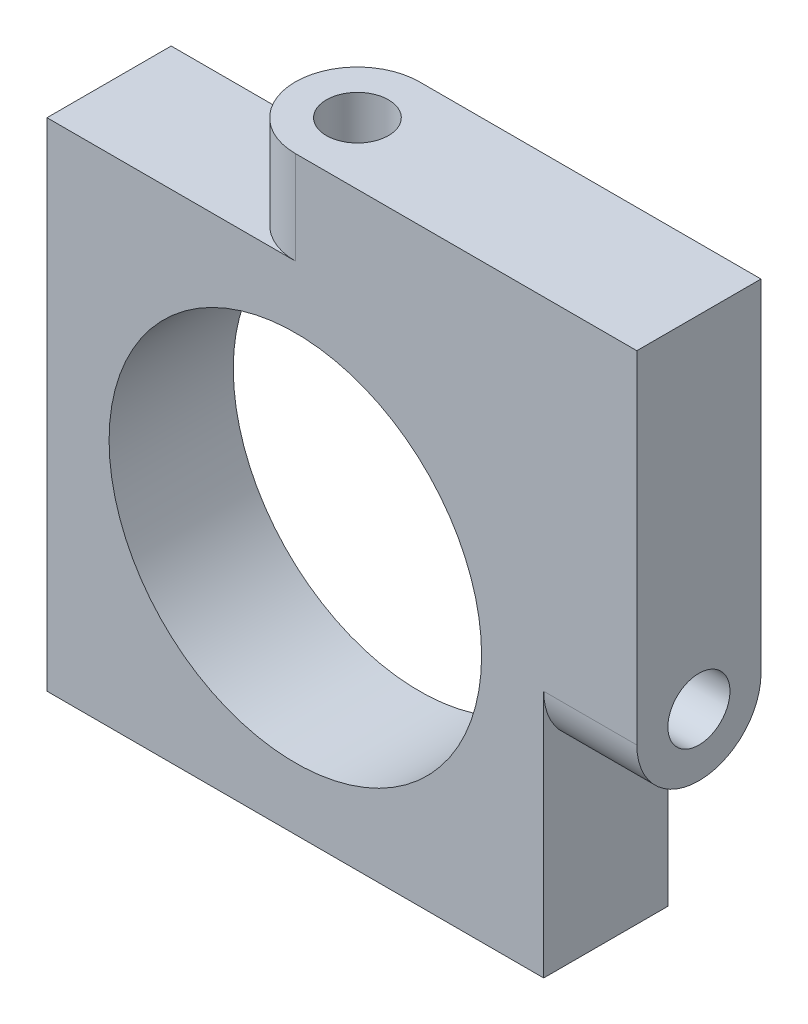
from build123d import *

# Parameters (mm, degrees)
SKETCH2_W           = 101.6
SKETCH2_H           = 101.6
SKETCH2_R           = 38.1
BOSS_EXTRUDE1_DEPTH = 25.4
SKETCH3_R           = 6.35
BOSS_EXTRUDE2_DEPTH = 19.05
SKETCH4_R           = 6.35
BOSS_EXTRUDE3_DEPTH = 19.05


with BuildPart() as part:
    # Sketch2 → Boss-Extrude1 (new body)
    with BuildSketch(Plane.XY):
        with Locations((50.8, 50.8)):
            Rectangle(SKETCH2_W, SKETCH2_H)
        with Locations((50.8, 50.8)):
            Circle(SKETCH2_R, mode=Mode.SUBTRACT)
    extrude(amount=BOSS_EXTRUDE1_DEPTH)

    # Sketch3 → Boss-Extrude2 (add)
    with BuildSketch(Plane(origin=(0, 101.6, 0), x_dir=(1, 0, 0), z_dir=(0, 1, 0))):
        with BuildLine():
            Line((101.6, -25.4), (101.6, 0))
            Line((101.6, 0), (50.8, 0))
            ThreePointArc((50.8, 0), (38.1, -12.7), (50.8, -25.4))
            Line((50.8, -25.4), (101.6, -25.4))
        make_face()
        with Locations((50.8, -12.7)):
            Circle(SKETCH3_R, mode=Mode.SUBTRACT)
    extrude(amount=BOSS_EXTRUDE2_DEPTH)

    # Sketch4 → Boss-Extrude3 (add)
    with BuildSketch(Plane(origin=(101.6, 0, 0), x_dir=(0, 0, -1), z_dir=(1, 0, 0))):
        with BuildLine():
            Line((0, 120.65), (-25.4, 120.65))
            Line((-25.4, 120.65), (-25.4, 50.8))
            ThreePointArc((-25.4, 50.8), (-12.7, 38.1), (0, 50.8))
            Line((0, 50.8), (0, 120.65))
        make_face()
        with Locations((-12.7, 50.8)):
            Circle(SKETCH4_R, mode=Mode.SUBTRACT)
    extrude(amount=BOSS_EXTRUDE3_DEPTH)


solid = part.part
